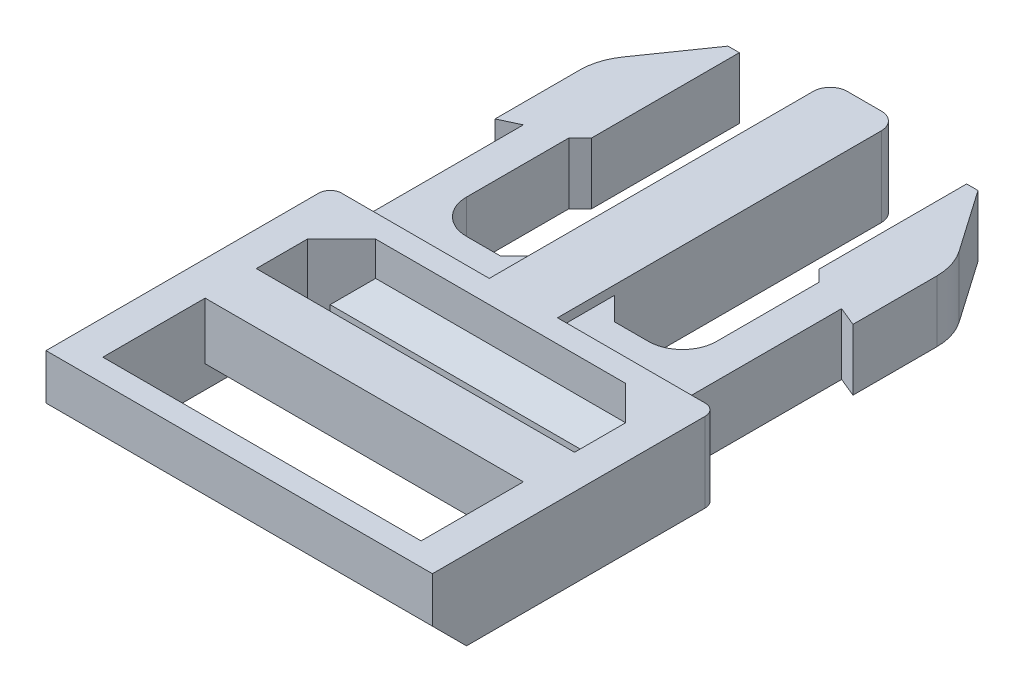
from build123d import *

# Parameters (mm, degrees)
SKETCH1_W            = 28
SKETCH1_H            = 3
BOSS_EXTRUDE1_DEPTH  = 7
SKETCH2_W            = 3
SKETCH2_H            = 7
BOSS_EXTRUDE2_DEPTH  = 26
SKETCH3_W            = 6
SKETCH3_H            = 7
BOSS_EXTRUDE3_DEPTH  = 27
BOSS_EXTRUDE4_DEPTH  = 7
CHAMFER1_SIZE        = 2
FILLET1_R            = 3
CUT_EXTRUDE1_DEPTH   = 8
SKETCH6_W            = 34
SKETCH6_H            = 7
BOSS_EXTRUDE5_DEPTH  = 25
SKETCH8_W            = 28
SKETCH8_H            = 21
CUT_EXTRUDE2_DEPTH   = 25
CHAMFER2_SIZE        = 3
FILLET2_R            = 1
SKETCH9_W            = 28
SKETCH9_H            = 4
BOSS_EXTRUDE6_DEPTH  = 7
SKETCH10_W           = 28
SKETCH10_H           = 2
BOSS_EXTRUDE7_DEPTH  = 4
CHAMFER3_SIZE        = 1
CHAMFER4_SIZE        = 3
CHAMFER5_SIZE        = 2
FILLET4_R            = 1.5
SKETCH11_W           = 14
SKETCH11_H           = 7
BOSS_EXTRUDE8_DEPTH  = 1
CHAMFER6_SIZE        = 1
SKETCH12_W           = 14
SKETCH12_H           = 7
BOSS_EXTRUDE9_DEPTH  = 1
CHAMFER7_SIZE        = 1
SKETCH13_W           = 30
SKETCH13_H           = 0.8
CUT_EXTRUDE3_DEPTH   = 12.7
SKETCH14_W           = 30
SKETCH14_H           = 0.8
CUT_EXTRUDE4_DEPTH   = 12.7
BOSS_EXTRUDE10_DEPTH = 5.4
FILLET5_R            = 5
CHAMFER8_SIZE        = 3
SKETCH16_W           = 28
SKETCH16_H           = 2
BOSS_EXTRUDE11_DEPTH = 2
CHAMFER9_SIZE        = 2
SKETCH17_W           = 30.68644474
SKETCH17_H           = 2
BOSS_EXTRUDE12_DEPTH = 2
CHAMFER10_SIZE       = 2
CHAMFER11_SIZE       = 1.5
CHAMFER12_SIZE       = 1


with BuildPart() as part:
    # Sketch1 → Boss-Extrude1 (new body)
    with BuildSketch(Plane(origin=(0, 0, 0), x_dir=(1, 0, 0), z_dir=(0, 1, 0))):
        Rectangle(SKETCH1_W, SKETCH1_H)
    extrude(amount=BOSS_EXTRUDE1_DEPTH)

    # Sketch2 → Boss-Extrude2 (add)
    with BuildSketch(Plane(origin=(0, 0, -1.5), x_dir=(-1, 0, 0), z_dir=(0, 0, -1))):
        with Locations((12.5, 3.5)):
            Rectangle(SKETCH2_W, SKETCH2_H)
        with Locations((-12.5, 3.5)):
            Rectangle(SKETCH2_W, SKETCH2_H)
    extrude(amount=BOSS_EXTRUDE2_DEPTH)

    # Sketch3 → Boss-Extrude3 (add)
    with BuildSketch(Plane(origin=(0, 0, -1.5), x_dir=(-1, 0, 0), z_dir=(0, 0, -1))):
        with Locations((0, 3.5)):
            Rectangle(SKETCH3_W, SKETCH3_H)
    extrude(amount=BOSS_EXTRUDE3_DEPTH)

    # Sketch4 → Boss-Extrude4 (add)
    with BuildSketch(Plane(origin=(0, 7, 0), x_dir=(1, 0, 0), z_dir=(0, 1, 0))):
        Polygon((-14, 12.5), (-15.7, 11.707276981), (-15.7, 16.707276981), (-14, 19.5), align=None)
        Polygon((14, 12.5), (15.7, 11.800538513), (15.7, 16.800538513), (14, 19.5), align=None)
    extrude(amount=-BOSS_EXTRUDE4_DEPTH)

    # Chamfer1
    chamfer1_edges = [part.edges().sort_by_distance(p)[0] for p in [
        (3, 3.5, -1.5),
        (-3, 3.5, -1.5),
    ]]
    chamfer(chamfer1_edges, length=CHAMFER1_SIZE)

    # Fillet1
    fillet1_edges = [part.edges().sort_by_distance(p)[0] for p in [
        (-11, 3.5, -1.5),
        (11, 3.5, -1.5),
    ]]
    fillet(fillet1_edges, radius=FILLET1_R)

    # Sketch5 → Cut-Extrude1 (cut)
    with BuildSketch(Plane(origin=(0, 7, 0), x_dir=(1, 0, 0), z_dir=(0, 1, 0))):
        Polygon((-14, 21.5), (-11, 27.5), (-14, 27.5), align=None)
        Polygon((14, 21.5), (11, 27.5), (14, 27.5), align=None)
    extrude(amount=-CUT_EXTRUDE1_DEPTH, mode=Mode.SUBTRACT)

    # Sketch6 → Boss-Extrude5 (add)
    with BuildSketch(Plane.XY.offset(1.5)):
        with Locations((0, 3.5)):
            Rectangle(SKETCH6_W, SKETCH6_H)
    extrude(amount=BOSS_EXTRUDE5_DEPTH)

    # Sketch8 → Cut-Extrude2 (cut)
    with BuildSketch(Plane(origin=(0, 7, 0), x_dir=(1, 0, 0), z_dir=(0, 1, 0))):
        with Locations((0, -14)):
            Rectangle(SKETCH8_W, SKETCH8_H)
    extrude(amount=-CUT_EXTRUDE2_DEPTH, mode=Mode.SUBTRACT)

    # Chamfer2
    chamfer2_edges = [part.edges().sort_by_distance(p)[0] for p in [
        (-14, 3.5, 3.5),
        (14, 3.5, 3.5),
    ]]
    chamfer(chamfer2_edges, length=CHAMFER2_SIZE)

    # Fillet2
    fillet2_edges = [part.edges().sort_by_distance(p)[0] for p in [
        (-17, 3.5, 1.5),
        (17, 3.5, 1.5),
    ]]
    fillet(fillet2_edges, radius=FILLET2_R)

    # Sketch9 → Boss-Extrude6 (add)
    with BuildSketch(Plane(origin=(0, 7, 0), x_dir=(1, 0, 0), z_dir=(0, 1, 0))):
        with Locations((0, -13.5)):
            Rectangle(SKETCH9_W, SKETCH9_H)
    extrude(amount=-BOSS_EXTRUDE6_DEPTH)

    # Sketch10 → Boss-Extrude7 (add)
    with BuildSketch(Plane(origin=(0, 0, 24.5), x_dir=(-1, 0, 0), z_dir=(0, 0, -1))):
        with Locations((0, 1)):
            Rectangle(SKETCH10_W, SKETCH10_H)
    extrude(amount=BOSS_EXTRUDE7_DEPTH)

    # Chamfer3
    chamfer3_edges = [part.edges().sort_by_distance(p)[0] for p in [
        (0, 2, 20.5),
    ]]
    chamfer(chamfer3_edges, length=CHAMFER3_SIZE)

    # Chamfer4
    chamfer4_edges = [part.edges().sort_by_distance(p)[0] for p in [
        (0, 2, 24.5),
    ]]
    chamfer(chamfer4_edges, length=CHAMFER4_SIZE - 0.0001)  # a hair under: the kernel refuses the full size

    # Chamfer5
    chamfer5_edges = [part.edges().sort_by_distance(p)[0] for p in [
        (0, 0, 15.5),
    ]]
    chamfer(chamfer5_edges, length=CHAMFER5_SIZE)

    # Fillet4
    fillet4_edges = [part.edges().sort_by_distance(p)[0] for p in [
        (3, 3.5, -28.5),
        (-3, 3.5, -28.5),
    ]]
    fillet(fillet4_edges, radius=FILLET4_R)

    # Sketch11 → Boss-Extrude8 (add)
    with BuildSketch(Plane(origin=(-11, 0, 0), x_dir=(0, 0, -1), z_dir=(1, 0, 0))):
        with Locations((20.5, 3.5)):
            Rectangle(SKETCH11_W, SKETCH11_H)
    extrude(amount=BOSS_EXTRUDE8_DEPTH)

    # Chamfer6
    chamfer6_edges = [part.edges().sort_by_distance(p)[0] for p in [
        (-10, 3.5, -13.5),
    ]]
    chamfer(chamfer6_edges, length=CHAMFER6_SIZE - 0.0001)  # a hair under: the kernel refuses the full size

    # Sketch12 → Boss-Extrude9 (add)
    with BuildSketch(Plane.ZY.offset(-11)):
        with Locations((-20.5, 3.5)):
            Rectangle(SKETCH12_W, SKETCH12_H)
    extrude(amount=BOSS_EXTRUDE9_DEPTH)

    # Chamfer7
    chamfer7_edges = [part.edges().sort_by_distance(p)[0] for p in [
        (10, 3.5, -13.5),
    ]]
    chamfer(chamfer7_edges, length=CHAMFER7_SIZE - 0.0001)  # a hair under: the kernel refuses the full size

    # Sketch13 → Cut-Extrude3 (cut)
    with BuildSketch(Plane(origin=(15.7, 0, 0), x_dir=(0, 0, -1), z_dir=(1, 0, 0))):
        with Locations((13.5, 6.6)):
            Rectangle(SKETCH13_W, SKETCH13_H)
        with Locations((13.5, 0.4)):
            Rectangle(SKETCH13_W, SKETCH13_H)
    extrude(amount=-CUT_EXTRUDE3_DEPTH, mode=Mode.SUBTRACT)

    # Sketch14 → Cut-Extrude4 (cut)
    with BuildSketch(Plane.ZY.offset(15.7)):
        with Locations((-13.5, 6.6)):
            Rectangle(SKETCH14_W, SKETCH14_H)
        with Locations((-13.5, 0.4)):
            Rectangle(SKETCH14_W, SKETCH14_H)
    extrude(amount=-CUT_EXTRUDE4_DEPTH, mode=Mode.SUBTRACT)

    # Sketch15 → Boss-Extrude10 (add)
    with BuildSketch(Plane(origin=(0, 6.2, 0), x_dir=(1, 0, 0), z_dir=(0, 1, 0))):
        Polygon((-15.7, 16.707276981), (-15.7, 20.746872846), (-11, 27.5), (-14, 19.5), align=None)
        Polygon((15.7, 16.800538513), (15.7, 20.746872846), (11, 27.5), (14, 19.5), align=None)
    extrude(amount=-BOSS_EXTRUDE10_DEPTH)

    # Fillet5
    fillet5_edges = [part.edges().sort_by_distance(p)[0] for p in [
        (-15.7, 3.5, -20.746872846),
        (15.7, 3.5, -20.746872846),
    ]]
    fillet(fillet5_edges, radius=FILLET5_R)

    # Chamfer8
    chamfer8_edges = [part.edges().sort_by_distance(p)[0] for p in [
        (0, 0, 26.5),
    ]]
    chamfer(chamfer8_edges, length=CHAMFER8_SIZE)

    # Sketch16 → Boss-Extrude11 (add)
    with BuildSketch(Plane(origin=(0, 0, 11.5), x_dir=(-1, 0, 0), z_dir=(0, 0, -1))):
        with Locations((0, 6)):
            Rectangle(SKETCH16_W, SKETCH16_H)
    extrude(amount=BOSS_EXTRUDE11_DEPTH)

    # Chamfer9
    chamfer9_edges = [part.edges().sort_by_distance(p)[0] for p in [
        (0, 5, 11.5),
    ]]
    chamfer(chamfer9_edges, length=CHAMFER9_SIZE - 0.0001)  # a hair under: the kernel refuses the full size

    # Sketch17 → Boss-Extrude12 (add)
    with BuildSketch(Plane.XY.offset(3.5)):
        with Locations((0.267537513, 1)):
            Rectangle(SKETCH17_W, SKETCH17_H)
    extrude(amount=BOSS_EXTRUDE12_DEPTH)

    # Chamfer10
    chamfer10_edges = [part.edges().sort_by_distance(p)[0] for p in [
        (0, 2, 3.5),
    ]]
    chamfer(chamfer10_edges, length=CHAMFER10_SIZE - 0.0001)  # a hair under: the kernel refuses the full size

    # Chamfer11
    chamfer11_edges = [part.edges().sort_by_distance(p)[0] for p in [
        (0, 7, 9.5),
    ]]
    chamfer(chamfer11_edges, length=CHAMFER11_SIZE)

    # Chamfer12
    chamfer12_edges = [part.edges().sort_by_distance(p)[0] for p in [
        (-14, 0.5, 20.5),
        (14, 0.5, 20.5),
    ]]
    chamfer(chamfer12_edges, length=CHAMFER12_SIZE - 0.0001)  # a hair under: the kernel refuses the full size


solid = part.part
